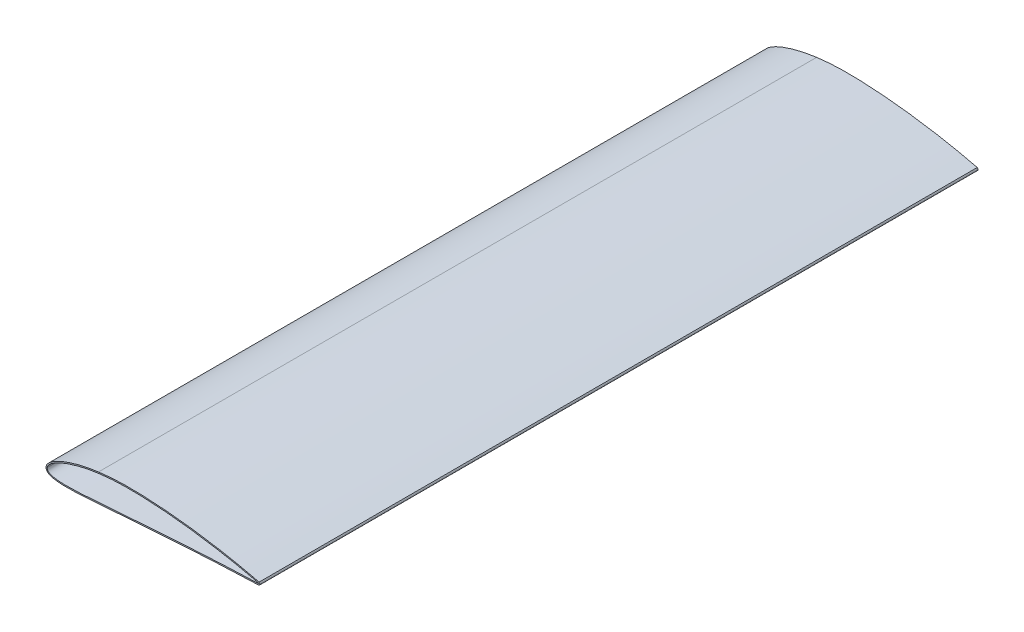
from build123d import *

# Parameters (mm, degrees)
THICKEN_START   = -1635.919131198
THICKEN_1_DEPTH = 1188.8


with BuildPart() as part:
    # Придать толщину1: read off the stored shape, not the designer's step
    # Придать толщину1 outline → Придать толщину1 (new body)
    with BuildSketch(Plane.XY.offset(THICKEN_START)):
        with BuildLine():
            add(Edge.make_bspline(
                [(-33.84832673, 60.046982914), (-33.674338637, 60.069412358), (-33.500349924, 60.091836863), (-32.974459241, 60.159576479), (-32.622552257, 60.204851629), (-31.917193889, 60.296004625), (-31.563742731, 60.341884271), (-30.855255633, 60.431441623), (-30.500218605, 60.475110717), (-29.790844384, 60.561507576), (-29.43650742, 60.604237242), (-28.72770551, 60.688509772), (-28.373240568, 60.730052681), (-27.309694901, 60.853038068), (-26.600424075, 60.93284199), (-25.181452695, 61.088057288), (-24.471752174, 61.163468965), (-22.342122488, 61.383209833), (-20.921519848, 61.521061645), (-18.078964123, 61.779863968), (-16.657011237, 61.900816646), (-13.811998698, 62.126231428), (-12.38893922, 62.230695759), (-8.118725971, 62.51996727), (-5.269912307, 62.680709496), (0.429954703, 62.940691164), (3.281007522, 63.039942258), (7.558530681, 63.144139344), (8.984488737, 63.171424974), (11.836455967, 63.211021692), (13.262465117, 63.223334462), (17.53816452, 63.239243251), (20.387931415, 63.221865944), (26.084200103, 63.146793255), (28.930702465, 63.089135435), (33.19921025, 62.978022324), (34.621548302, 62.936891132), (37.465980753, 62.846965665), (38.888075153, 62.798171406), (41.732084627, 62.692557452), (43.153999675, 62.635737093), (45.997505114, 62.513770395), (47.419095497, 62.448623865), (50.261712094, 62.310343948), (51.682738357, 62.237211548), (53.813887707, 62.121665159), (54.524170923, 62.082177149), (55.589510631, 62.021759246), (55.944600665, 62.001422829), (56.655123354, 61.959888619), (57.010555953, 61.938689902), (57.720158869, 61.89623331), (58.074329214, 61.874975909), (58.783917277, 61.832254497), (59.139334969, 61.810790022), (60.204740165, 61.745332765), (60.914659486, 61.700231509), (63.044209592, 61.562466652), (64.463680487, 61.467339083), (68.721145109, 61.170920322), (71.55837846, 60.958581965), (77.230382265, 60.50627203), (80.065152907, 60.266302769), (88.565304794, 59.506172992), (94.227132575, 58.945747804), (105.539176702, 57.72346481), (111.18939416, 57.061617237), (122.4771869, 55.640881259), (128.114763078, 54.881999962), (139.376187428, 53.270311029), (145.000036231, 52.417507796), (156.232862942, 50.619885512), (161.841841211, 49.675068716), (173.043683467, 47.694416064), (178.63654749, 46.65858041), (189.804671034, 44.495527976), (195.379930369, 43.368310237), (203.728421617, 41.608888174), (206.508919625, 41.010966254), (212.064704706, 39.791397398), (214.839991805, 39.169750584), (218.998965602, 38.220432999), (220.384586024, 37.901196495), (223.154989173, 37.257014414), (224.53977147, 36.932066974), (227.306993691, 36.274663746), (228.689434305, 35.942210851), (230.749444352, 35.444457982), (231.427287302, 35.280292747), (232.10510825, 35.116041716)],
                knots=[2.666986261, 2.666986261, 2.666986261, 2.666986261, 3.193269836, 3.193269836, 4.257693178, 4.257693178, 5.326938756, 5.326938756, 6.400071122, 6.400071122, 7.470782875, 7.470782875, 8.541454089, 8.541454089, 10.682677869, 10.682677869, 12.823754333, 12.823754333, 17.105468326, 17.105468326, 21.386632505, 21.386632505, 25.667218166, 25.667218166, 34.226507052, 34.226507052, 42.784173486, 42.784173486, 47.062764832, 47.062764832, 51.340875943, 51.340875943, 59.889883556, 59.889883556, 68.43092978, 68.43092978, 72.699710261, 72.699710261, 76.968481918, 76.968481918, 81.237607599, 81.237607599, 85.506831401, 85.506831401, 89.775527916, 89.775527916, 91.909666445, 91.909666445, 92.976681523, 92.976681523, 94.044873562, 94.044873562, 95.109296922, 95.109296922, 96.177492151, 96.177492151, 98.311539724, 98.311539724, 102.579490719, 102.579490719, 111.114828696, 111.114828696, 119.649451327, 119.649451327, 136.71687267, 136.71687267, 153.782573081, 153.782573081, 170.847023941, 170.847023941, 187.910675412, 187.910675412, 204.973908869, 204.973908869, 222.037104364, 222.037104364, 239.100478649, 239.100478649, 247.632579391, 247.632579391, 256.164636416, 256.164636416, 260.430389305, 260.430389305, 264.697559007, 264.697559007, 268.963110121, 268.963110121, 271.055422061, 271.055422061, 271.055422061, 271.055422061], degree=3))
            add(Edge.make_bspline(
                [(-120.674471263, 24.080849815), (-120.652227017, 24.206179132), (-120.630077398, 24.33155384), (-120.581453233, 24.595551197), (-120.554770196, 24.734134933), (-120.493448953, 25.02438344), (-120.4582769, 25.175940475), (-120.376633622, 25.485965186), (-120.329602177, 25.644287401), (-120.227546572, 25.952733731), (-120.172823812, 26.102958501), (-120.05807017, 26.39473334), (-119.998321908, 26.536395572), (-119.875375482, 26.811921525), (-119.812387452, 26.94587962), (-119.682696793, 27.209807919), (-119.616053561, 27.33980737), (-119.478862779, 27.596678466), (-119.408342438, 27.723564646), (-119.263692771, 27.974244912), (-119.189587676, 28.098052996), (-119.038098424, 28.342453855), (-118.960740678, 28.463063013), (-118.80333939, 28.700787781), (-118.72333021, 28.817926208), (-118.481094147, 29.162529664), (-118.314367379, 29.386842965), (-117.973998732, 29.823887612), (-117.800526812, 30.03675232), (-117.447210658, 30.453125996), (-117.267456839, 30.656711811), (-116.902765468, 31.055308196), (-116.717900913, 31.250385754), (-116.343671518, 31.633030099), (-116.154356359, 31.820645556), (-115.771963647, 32.188958546), (-115.578926922, 32.369698603), (-114.996811623, 32.901144213), (-114.601161849, 33.244674173), (-113.799609105, 33.911488475), (-113.393839429, 34.234934287), (-112.573992916, 34.865028624), (-112.159993971, 35.171778758), (-111.325211341, 35.770597779), (-110.904481501, 36.062742041), (-109.635974083, 36.91866837), (-108.776882183, 37.46571727), (-107.041534819, 38.519561609), (-106.165411018, 39.026576111), (-104.39948942, 40.007265422), (-103.509763088, 40.481069344), (-101.719017486, 41.400352319), (-100.818037151, 41.845907503), (-99.006824534, 42.712134291), (-98.096618809, 43.132861639), (-95.355918615, 44.36103206), (-93.51109844, 45.13660778), (-89.797224039, 46.61426695), (-87.92823167, 47.316507487), (-84.170750983, 48.657247364), (-82.282296088, 49.295840671), (-78.489441349, 50.516139884), (-76.585061236, 51.097907336), (-72.762979713, 52.209566063), (-70.845290444, 52.739499291), (-65.077030593, 54.257094085), (-61.207635634, 55.173700671), (-53.43655442, 56.838047706), (-49.534898411, 57.585931041), (-43.663950615, 58.59280873), (-41.704319568, 58.90922033), (-37.780020118, 59.505261598), (-35.815353256, 59.7849014), (-33.84832673, 60.046982914)],
                knots=[0, 0, 0, 0, 0.381912899, 0.381912899, 0.805273508, 0.805273508, 1.271821809, 1.271821809, 1.766952657, 1.766952657, 2.24635317, 2.24635317, 2.707440826, 2.707440826, 3.151427772, 3.151427772, 3.589604677, 3.589604677, 4.025024127, 4.025024127, 4.45782716, 4.45782716, 4.887617807, 4.887617807, 5.313134001, 5.313134001, 6.151229746, 6.151229746, 6.974798175, 6.974798175, 7.789361643, 7.789361643, 8.595486171, 8.595486171, 9.394963262, 9.394963262, 10.188208987, 10.188208987, 11.759519493, 11.759519493, 13.315886574, 13.315886574, 14.861374686, 14.861374686, 16.397823445, 16.397823445, 19.451964039, 19.451964039, 22.488030056, 22.488030056, 25.511550089, 25.511550089, 28.526541199, 28.526541199, 31.534483242, 31.534483242, 37.536121307, 37.536121307, 43.524627756, 43.524627756, 49.504157699, 49.504157699, 55.477138002, 55.477138002, 61.445243346, 61.445243346, 73.370037445, 73.370037445, 85.284694528, 85.284694528, 91.23942956, 91.23942956, 97.192520159, 97.192520159, 97.192520159, 97.192520159], degree=3))
            add(Edge.make_bspline(
                [(-120.674471263, 24.080849815), (-120.683195121, 23.961933496), (-120.692245243, 23.842989046), (-120.709689342, 23.585818111), (-120.717743278, 23.447569387), (-120.727734569, 23.153118238), (-120.728759693, 22.996877176), (-120.720405884, 22.677311768), (-120.71053662, 22.513998976), (-120.678009913, 22.184243855), (-120.655019442, 22.017833762), (-120.597076494, 21.691776388), (-120.562464087, 21.53206788), (-120.483553061, 21.219326035), (-120.439518024, 21.066225613), (-120.341319092, 20.762228657), (-120.287092896, 20.611352187), (-120.168040713, 20.31247367), (-120.103135619, 20.164503076), (-119.963976687, 19.874535308), (-119.889804461, 19.732498902), (-119.733141338, 19.455067923), (-119.65074621, 19.319619181), (-119.478971945, 19.056235848), (-119.389721646, 18.928217056), (-119.20533796, 18.679650481), (-119.110320976, 18.559016157), (-118.915283809, 18.324977298), (-118.815362143, 18.211490509), (-118.611353109, 17.991528236), (-118.507352288, 17.88497233), (-118.296335396, 17.678918303), (-118.189411225, 17.579325847), (-117.97339713, 17.38673891), (-117.864386564, 17.293655198), (-117.644276611, 17.113160027), (-117.533226779, 17.025688037), (-117.309320982, 16.855987103), (-117.196503567, 16.773707223), (-116.969471205, 16.614076585), (-116.855289645, 16.53667826), (-116.6258966, 16.386495068), (-116.510714126, 16.313665834), (-116.279539657, 16.172242355), (-116.163570885, 16.103610039), (-115.816650352, 15.90469081), (-115.583040713, 15.779019451), (-115.114968588, 15.540981162), (-114.880613557, 15.428400914), (-114.410424406, 15.214010807), (-114.174641606, 15.112088116), (-113.70214964, 14.917855741), (-113.465478296, 14.825453737), (-112.991922696, 14.64917728), (-112.755068668, 14.565221111), (-112.047698547, 14.325198694), (-111.574012948, 14.178431838), (-110.626094005, 13.907668829), (-110.151928024, 13.783432922), (-109.204112671, 13.553369655), (-108.730504, 13.447373415), (-107.783541365, 13.250534897), (-107.310207583, 13.159594441), (-105.894770448, 12.906268473), (-104.949492176, 12.761584949), (-103.061099039, 12.509436759), (-102.118017559, 12.401711742), (-100.233855369, 12.214743838), (-99.292788349, 12.135360803), (-97.41236115, 11.999479499), (-96.473006527, 11.942902098), (-93.660562863, 11.800880775), (-91.786112247, 11.742523477), (-88.042651178, 11.67729665), (-86.173642875, 11.670260162), (-82.439891516, 11.694240852), (-80.57514784, 11.725177172), (-76.849101929, 11.815815958), (-74.987798616, 11.875476771), (-71.268132481, 12.017107156), (-69.409768689, 12.099051879), (-63.840261769, 12.370610107), (-60.13039441, 12.58607749), (-52.71742128, 13.058496399), (-49.014312524, 13.315403181), (-41.612619935, 13.853004934), (-37.914034787, 14.133682008), (-30.519774956, 14.705835048), (-26.824099796, 14.997304947), (-19.434422556, 15.581203581), (-15.740420439, 15.873631851), (-8.35313817, 16.451881247), (-4.659858189, 16.737704551), (0.880356819, 17.156698998), (2.726923998, 17.294724508), (6.42008984, 17.566761356), (8.26668846, 17.700773262), (11.960026262, 17.963906251), (13.806765404, 18.09302788), (17.50113186, 18.346543265), (19.348759273, 18.470935569), (23.04503744, 18.717528212), (24.893688265, 18.839727486), (27.667152431, 19.023399215), (28.591976892, 19.084702217), (30.441814002, 19.208173887), (31.366826637, 19.27034278), (34.141210927, 19.457814315), (35.990514598, 19.584120535), (39.688776171, 19.837488578), (41.537734081, 19.964550278), (45.235476785, 20.219324816), (47.084261581, 20.347037609), (50.781718445, 20.602732011), (52.630390514, 20.730713606), (58.176053077, 21.114730063), (61.873037092, 21.370860612), (69.266806107, 21.880505076), (72.963591088, 22.134019257), (84.053429356, 22.888383333), (91.446903586, 23.383120621), (106.234893582, 24.341651626), (113.629409083, 24.805449408), (128.420207467, 25.695848843), (135.816490204, 26.122452911), (150.611170177, 26.933253787), (158.009567347, 27.317451811), (172.808568985, 28.044685384), (180.209173505, 28.387719905), (191.311463388, 28.872922203), (195.012514103, 29.029766908), (202.415135609, 29.334422541), (206.116706415, 29.482233109), (213.520403074, 29.769631298), (217.222528948, 29.909218391), (224.627408725, 30.181970061), (228.330162653, 30.31513396), (232.032995242, 30.445977173)],
                knots=[0, 0, 0, 0, 0.357803911, 0.357803911, 0.773195575, 0.773195575, 1.241622921, 1.241622921, 1.732025153, 1.732025153, 2.235465849, 2.235465849, 2.725300814, 2.725300814, 3.202898797, 3.202898797, 3.683517548, 3.683517548, 4.167871684, 4.167871684, 4.648226773, 4.648226773, 5.123526206, 5.123526206, 5.591419102, 5.591419102, 6.051856524, 6.051856524, 6.50526525, 6.50526525, 6.951773184, 6.951773184, 7.389986728, 7.389986728, 7.819901831, 7.819901831, 8.243886727, 8.243886727, 8.662700393, 8.662700393, 9.076450471, 9.076450471, 9.485212581, 9.485212581, 9.88943184, 9.88943184, 10.684862003, 10.684862003, 11.464622923, 11.464622923, 12.235046069, 12.235046069, 12.997108256, 12.997108256, 13.750893974, 13.750893974, 15.237937717, 15.237937717, 16.708087237, 16.708087237, 18.163791916, 18.163791916, 19.609594566, 19.609594566, 22.47739829, 22.47739829, 25.324564033, 25.324564033, 28.157449186, 28.157449186, 30.980417994, 30.980417994, 36.605343124, 36.605343124, 42.211960929, 42.211960929, 47.806660924, 47.806660924, 53.393272688, 53.393272688, 58.973680245, 58.973680245, 70.121565871, 70.121565871, 81.257493969, 81.257493969, 92.385110974, 92.385110974, 103.50656423, 103.50656423, 114.623241049, 114.623241049, 125.736195829, 125.736195829, 131.291347821, 131.291347821, 136.845707461, 136.845707461, 142.399443218, 142.399443218, 147.954869695, 147.954869695, 153.512925608, 153.512925608, 156.293487447, 156.293487447, 159.074785313, 159.074785313, 164.635620314, 164.635620314, 170.195576321, 170.195576321, 175.7551483, 175.7551483, 181.314438738, 181.314438738, 192.431975627, 192.431975627, 203.548378153, 203.548378153, 225.778363437, 225.778363437, 248.005422044, 248.005422044, 270.231037164, 270.231037164, 292.456015528, 292.456015528, 314.68154916, 314.68154916, 325.79465764, 325.79465764, 336.908208833, 336.908208833, 348.022472003, 348.022472003, 359.1379072, 359.1379072, 359.1379072, 359.1379072], degree=3))
            add(Edge.make_bspline(
                [(232.10510825, 35.116041716), (232.175752772, 35.04933105), (232.246307574, 34.982570868), (232.352171621, 34.882465806), (232.387464938, 34.849103325), (232.44043678, 34.799094796), (232.458099376, 34.782431147), (232.496251519, 34.746283784), (232.516728796, 34.726786512), (232.573278644, 34.670938253), (232.608527664, 34.633745185), (232.676688349, 34.557626759), (232.709610882, 34.51871106), (232.773042077, 34.439106932), (232.80355634, 34.39842298), (232.862188065, 34.315346745), (232.890304804, 34.272953953), (232.944109525, 34.18647693), (232.969789971, 34.142388007), (233.018675092, 34.052536036), (233.041865005, 34.006764955), (233.085600788, 33.913754812), (233.106135826, 33.866510653), (233.144265814, 33.771192332), (233.161878298, 33.72312518), (233.194188998, 33.626266882), (233.208900241, 33.577480081), (233.23543562, 33.479231281), (233.247265417, 33.429770811), (233.2680436, 33.330212393), (233.276989978, 33.280114025), (233.291983089, 33.1793132), (233.298019983, 33.12860928), (233.307151537, 33.026632874), (233.310228479, 32.975358801), (233.313360662, 32.872691015), (233.313414288, 32.821297252), (233.310511012, 32.718908285), (233.30757244, 32.66791256), (233.298742976, 32.566359495), (233.292862583, 32.515801243), (233.278183328, 32.415156491), (233.269387086, 32.36506961), (233.248885672, 32.265401567), (233.237175338, 32.215821466), (233.210832466, 32.117208547), (233.196187229, 32.068179121), (233.163947668, 31.9707479), (233.146334912, 31.922352201), (233.108344762, 31.826836166), (233.087976305, 31.779712274), (233.044636773, 31.687009506), (233.021681461, 31.641423259), (232.973230867, 31.551809792), (232.947743922, 31.507778061), (232.894277185, 31.421283697), (232.866298653, 31.378820287), (232.80784132, 31.29551674), (232.77735715, 31.254680384), (232.71398497, 31.174579585), (232.681085993, 31.135323748), (232.626086557, 31.073961748), (232.604778897, 31.051138285), (232.566734886, 31.010722262), (232.550034791, 30.993094236), (232.499963925, 30.940181424), (232.466622549, 30.904867881), (232.366578844, 30.798946447), (232.299856919, 30.728357726), (232.166413032, 30.587180247), (232.099691071, 30.516591489), (232.032995242, 30.445977173)],
                knots=[0, 0, 0, 0, 0.29139611, 0.29139611, 0.43709412, 0.43709412, 0.509943169, 0.509943169, 0.594759966, 0.594759966, 0.74837763, 0.74837763, 0.901222306, 0.901222306, 1.053700317, 1.053700317, 1.206224176, 1.206224176, 1.359205384, 1.359205384, 1.513048409, 1.513048409, 1.667500633, 1.667500633, 1.82098986, 1.82098986, 1.973773383, 1.973773383, 2.126254306, 2.126254306, 2.278841202, 2.278841202, 2.431940501, 2.431940501, 2.585950517, 2.585950517, 2.740042777, 2.740042777, 2.893196813, 2.893196813, 3.045808175, 3.045808175, 3.198282839, 3.198282839, 3.351029505, 3.351029505, 3.504451974, 3.504451974, 3.658865104, 3.658865104, 3.81278894, 3.81278894, 3.965820994, 3.965820994, 4.118364844, 4.118364844, 4.270832, 4.270832, 4.423634863, 4.423634863, 4.57718057, 4.57718057, 4.670840497, 4.670840497, 4.743689563, 4.743689563, 4.889387593, 4.889387593, 5.180783566, 5.180783566, 5.472179693, 5.472179693, 5.472179693, 5.472179693], degree=3))
        make_face()
        with BuildLine():
            add(Edge.make_bspline(
                [(231.142619967, 32.415690997), (224.015188216, 32.163208953), (209.760962964, 31.640469633), (181.257295601, 30.473042399), (145.639505994, 28.742372885), (102.923978918, 26.190725313), (74.462821386, 24.246311709), (60.00014075, 23.245777546), (59.534199704, 23.213526156), (58.835288136, 23.165149072), (58.136376567, 23.116771987), (57.670435517, 23.084520597), (53.809296548, 22.817150625), (46.552977135, 22.314398412), (37.482317951, 21.689772106), (30.225343058, 21.196500106), (22.967437198, 20.717303524), (13.895349809, 20.113373003), (3.013021689, 19.328290273), (-7.865979836, 18.498753187), (-18.742968476, 17.643321818), (-25.99392444, 17.068381919), (-29.852564327, 16.765881103), (-30.318385969, 16.729476783), (-31.017116978, 16.674870418), (-31.715850883, 16.620263827), (-32.181678317, 16.583859055), (-34.300636543, 16.418809757), (-38.072894355, 16.127522844), (-43.732201703, 15.70231167), (-49.392771862, 15.294242114), (-55.054994662, 14.909527881), (-60.719236512, 14.555654769), (-66.385853398, 14.241628117), (-72.05510616, 13.979045455), (-76.781751593, 13.814975726), (-80.564261945, 13.726694462), (-83.40160919, 13.68497805), (-86.239246867, 13.671358159), (-89.07685285, 13.690962653), (-91.913987156, 13.748093791), (-94.749825509, 13.851158644), (-97.583315136, 14.0076091), (-100.412358834, 14.230337502), (-103.234127766, 14.534358264), (-106.042625371, 14.942869786), (-108.828723719, 15.488668585), (-111.570739541, 16.226140594), (-113.784108377, 17.074052372), (-115.450463953, 17.976032157), (-116.415801848, 18.66357871), (-117.113280812, 19.304380148), (-117.585469627, 19.835123428), (-117.993821467, 20.416737744), (-118.323158378, 21.047296598), (-118.560307607, 21.717249894), (-118.70849199, 22.413341373), (-118.741083754, 23.124019902), (-118.704680178, 23.595929204), (-118.687372844, 23.83176129)],
                knots=[0, 0, 0, 0, 0.060293183, 0.120586366, 0.241172733, 0.361759099, 0.482345466, 0.482345466, 0.484319726, 0.486293985, 0.488268245, 0.490242504, 0.490242504, 0.520988718, 0.551734932, 0.567108039, 0.582481145, 0.613227359, 0.643973573, 0.674719786, 0.705466, 0.736212214, 0.736212214, 0.738187268, 0.740162323, 0.742137377, 0.744112431, 0.744112431, 0.760105404, 0.776098377, 0.792091351, 0.808084324, 0.824077297, 0.84007027, 0.856063243, 0.872056216, 0.880052702, 0.888049189, 0.896045675, 0.904042162, 0.912038648, 0.920035135, 0.928031621, 0.936028108, 0.944024594, 0.952021081, 0.960017567, 0.968014054, 0.97601054, 0.980008784, 0.984007027, 0.986006149, 0.98800527, 0.990004392, 0.992003513, 0.994002635, 0.996001757, 0.998000878, 1, 1, 1, 1], degree=3))
            add(Edge.make_bspline(
                [(-118.687372844, 23.83176129), (-118.621774479, 24.200306818), (-118.484587003, 24.971055159), (-118.018663218, 26.119859924), (-117.354651331, 27.314166444), (-116.453903054, 28.560442635), (-115.295252706, 29.879924672), (-113.823334928, 31.298204429), (-111.959648904, 32.85009264), (-109.589429186, 34.575351938), (-106.565077846, 36.511003649), (-102.731122313, 38.672720668), (-97.981825829, 41.030764717), (-92.321256016, 43.503114225), (-85.871518868, 45.979105096), (-78.817532492, 48.357559479), (-71.334550732, 50.570207392), (-63.55120298, 52.581764135), (-55.550843575, 54.378364011), (-47.386317944, 55.95734997), (-40.047446919, 57.163651241), (-35.43119356, 57.818434506), (-33.588432616, 58.06392129)],
                knots=[0, 0, 0, 0, 0.01184948, 0.024781108, 0.039085817, 0.0551424, 0.073460486, 0.094734523, 0.119926883, 0.150348204, 0.187687565, 0.233789138, 0.289924431, 0.355848177, 0.429693804, 0.509049345, 0.591970958, 0.677217059, 0.76406156, 0.85208174, 0.941019153, 1, 1, 1, 1], degree=3))
            add(Edge.make_bspline(
                [(-33.588432616, 58.06392129), (-33.35585397, 58.093900306), (-32.890696667, 58.15385834), (-32.192960683, 58.243795395), (-31.495224681, 58.333732452), (-31.030067339, 58.39369049), (-23.575851085, 59.323567486), (-12.700212744, 60.322262104), (1.838594678, 61.030287482), (12.753504073, 61.265361084), (23.670226069, 61.2108111), (34.583918576, 60.960978129), (45.493034395, 60.560248773), (52.761005867, 60.183885404), (56.627411295, 59.95815361), (57.095058577, 59.930085782), (57.796529488, 59.88798404), (58.49800038, 59.845882299), (58.965647623, 59.817814472), (66.442687119, 59.356478375), (80.917106252, 58.268963132), (102.58230556, 56.109801073), (124.192661458, 53.458530353), (145.740483758, 50.340320573), (167.217971778, 46.769996769), (185.050233443, 43.423647908), (199.271624246, 40.522830523), (209.914288355, 38.235487489), (218.761850581, 36.232824235), (225.827443101, 34.576851943), (229.354438405, 33.724527418), (231.117681291, 33.297338355)],
                knots=[0, 0, 0, 0, 0.002633648, 0.005267296, 0.007900944, 0.010534592, 0.010534592, 0.09226643, 0.133132349, 0.173998268, 0.214864187, 0.255730106, 0.296596025, 0.337461944, 0.337461944, 0.340092689, 0.342723435, 0.345354181, 0.347984926, 0.347984926, 0.429486811, 0.510988695, 0.592490579, 0.673992463, 0.755494347, 0.836996232, 0.877747174, 0.918498116, 0.959249058, 0.979624529, 1, 1, 1, 1], degree=3))
            add(Edge.make_bspline(
                [(231.117681291, 33.297338355), (231.177017208, 33.241266903), (231.273405736, 33.105529122), (231.328982161, 32.862138914), (231.287252883, 32.615996273), (231.198691418, 32.475026913), (231.142619967, 32.415690997)],
                knots=[0, 0, 0, 0, 0.25, 0.5, 0.75, 1, 1, 1, 1], degree=3))
        make_face(mode=Mode.SUBTRACT)
    extrude(amount=THICKEN_1_DEPTH)


solid = part.part
